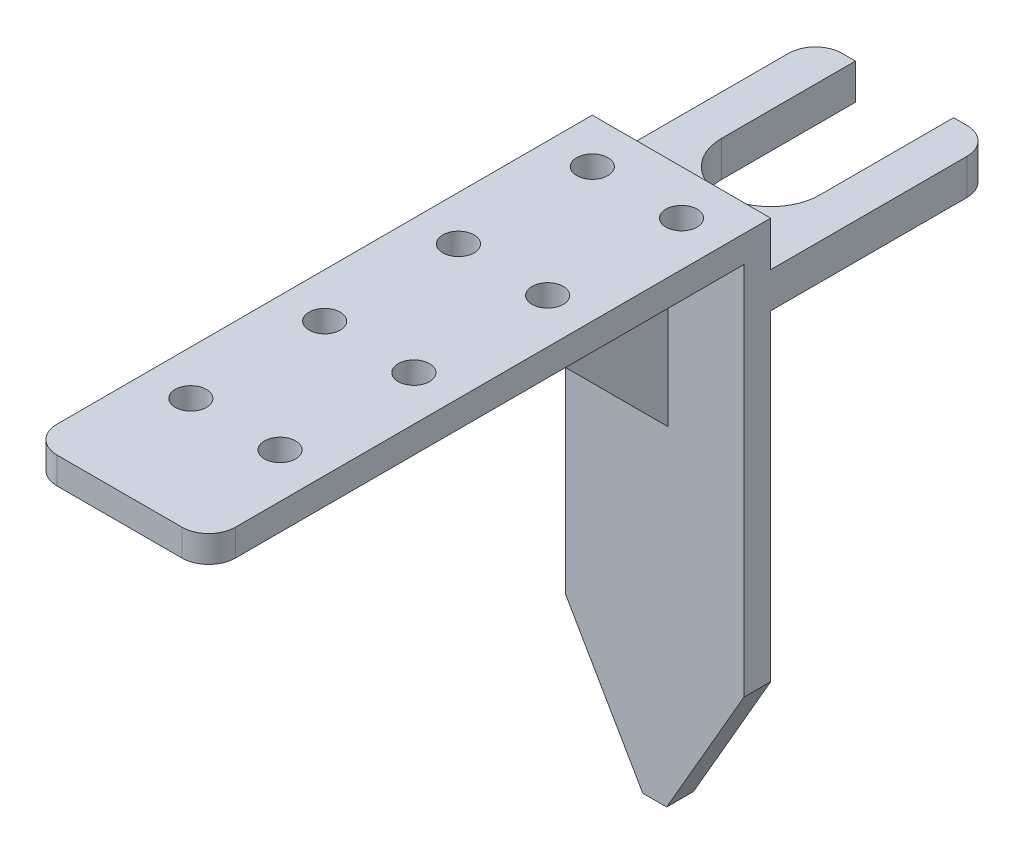
from build123d import *
from OCP.BRepFilletAPI import BRepFilletAPI_MakeChamfer

# Parameters (mm, degrees)
SKETCH1_W           = 20
SKETCH1_H           = 60
BOSS_EXTRUDE1_DEPTH = 3
SKETCH2_W           = 20
SKETCH2_H           = 3
BOSS_EXTRUDE2_DEPTH = 60
SKETCH3_W           = 3
SKETCH3_H           = 15
BOSS_EXTRUDE3_DEPTH = 20
CHAMFER1_SIZE       = 15
SKETCH4_R           = 1.75
CUT_EXTRUDE1_DEPTH  = 86.545309632
LPATTERN1_COUNT     = 4
LPATTERN1_PITCH     = 15
CHAMFER2_SIZE       = 15
CHAMFER2_SIZE2      = 8.660254038
FILLET1_R           = 3
SKETCH5_W           = 20
SKETCH5_H           = 4
BOSS_EXTRUDE4_DEPTH = 25
CUT_EXTRUDE2_DEPTH  = 85.225886757
FILLET2_R           = 3


with BuildPart() as part:
    # Sketch1 → Boss-Extrude1 (new body)
    with BuildSketch(Plane.XY):
        Rectangle(SKETCH1_W, SKETCH1_H)
    extrude(amount=BOSS_EXTRUDE1_DEPTH)

    # Sketch2 → Boss-Extrude2 (add)
    with BuildSketch(Plane.XY.offset(3)):
        with Locations((0, 28.5)):
            Rectangle(SKETCH2_W, SKETCH2_H)
    extrude(amount=BOSS_EXTRUDE2_DEPTH)

    # Sketch3 → Boss-Extrude3 (add)
    with BuildSketch(Plane.XZ.offset(-27)):
        with Locations((0, 10.5)):
            Rectangle(SKETCH3_W, SKETCH3_H)
    extrude(amount=BOSS_EXTRUDE3_DEPTH)

    # Chamfer1
    chamfer1_edges = [part.edges().sort_by_distance(p)[0] for p in [
        (0, 7, 18),
    ]]
    chamfer(chamfer1_edges, length=CHAMFER1_SIZE - 0.0001)  # a hair under: the kernel refuses the full size

    # Sketch4 → Cut-Extrude1 (cut, through all)
    with BuildSketch(Plane.XZ.offset(-27)):
        with Locations(Location((-5, 5, 0), (0, 0, 270))):
            Circle(SKETCH4_R)
        with Locations(Location((5, 5, 0), (0, 0, 270))):
            Circle(SKETCH4_R)
    cut_extrude1 = extrude(amount=-CUT_EXTRUDE1_DEPTH, mode=Mode.SUBTRACT)

    # LPattern1: Cut-Extrude1 ×4
    with Locations(*[(0, 0, i * LPATTERN1_PITCH) for i in range(1, LPATTERN1_COUNT)]):
        add(cut_extrude1, mode=Mode.SUBTRACT)

    # Chamfer2: one chamfer whose edges measure the first distance from different faces: ONE call of the kernel's chamfer builder (chamfer() names one face for all edges)
    chamfer2_edges_1 = [part.edges().sort_by_distance(p)[0] for p in [
        (10, -30, 1.5),
    ]]
    chamfer2_side_1 = [part.faces().sort_by_distance(p)[0] for p in [
        (10, 29.13, 31.5),
    ]]
    chamfer2_edges_2 = [part.edges().sort_by_distance(p)[0] for p in [
        (-10, -30, 1.5),
    ]]
    chamfer2_side_2 = [part.faces().sort_by_distance(p)[0] for p in [
        (-10, -29.13, 1.5),
    ]]
    chamfer2 = BRepFilletAPI_MakeChamfer(part.part.solid().wrapped)
    for e in chamfer2_edges_1:
        chamfer2.Add(CHAMFER2_SIZE, CHAMFER2_SIZE2, e.wrapped, chamfer2_side_1[0].wrapped)  # the first distance lies on this face
    for e in chamfer2_edges_2:
        chamfer2.Add(CHAMFER2_SIZE, CHAMFER2_SIZE2, e.wrapped, chamfer2_side_2[0].wrapped)  # the first distance lies on this face
    add(Compound.cast(chamfer2.Shape()), mode=Mode.REPLACE)

    # Fillet1
    fillet1_edges = [part.edges().sort_by_distance(p)[0] for p in [
        (-10, 28.5, 63),
        (10, 28.5, 63),
    ]]
    fillet(fillet1_edges, radius=FILLET1_R)

    # Sketch5 → Boss-Extrude4 (add)
    with BuildSketch(Plane(origin=(0, 0, 0), x_dir=(-1, 0, 0), z_dir=(0, 0, -1))):
        with Locations((0, 23)):
            Rectangle(SKETCH5_W, SKETCH5_H)
    extrude(amount=BOSS_EXTRUDE4_DEPTH)

    # Sketch6 → Cut-Extrude2 (cut, through all)
    with BuildSketch(Plane(origin=(0, 25, 0), x_dir=(1, 0, 0), z_dir=(0, 1, 0))):
        with BuildLine():
            Line((-5.5, 10), (-5.5, 25))
            Line((-5.5, 25), (5.5, 25))
            Line((5.5, 25), (5.5, 10))
            ThreePointArc((5.5, 10), (0, 4.5), (-5.5, 10))
        make_face()
    extrude(amount=-CUT_EXTRUDE2_DEPTH, mode=Mode.SUBTRACT)

    # Fillet2
    fillet2_edges = [part.edges().sort_by_distance(p)[0] for p in [
        (10, 23, -25),
        (-10, 23, -25),
    ]]
    fillet(fillet2_edges, radius=FILLET2_R)


solid = part.part
